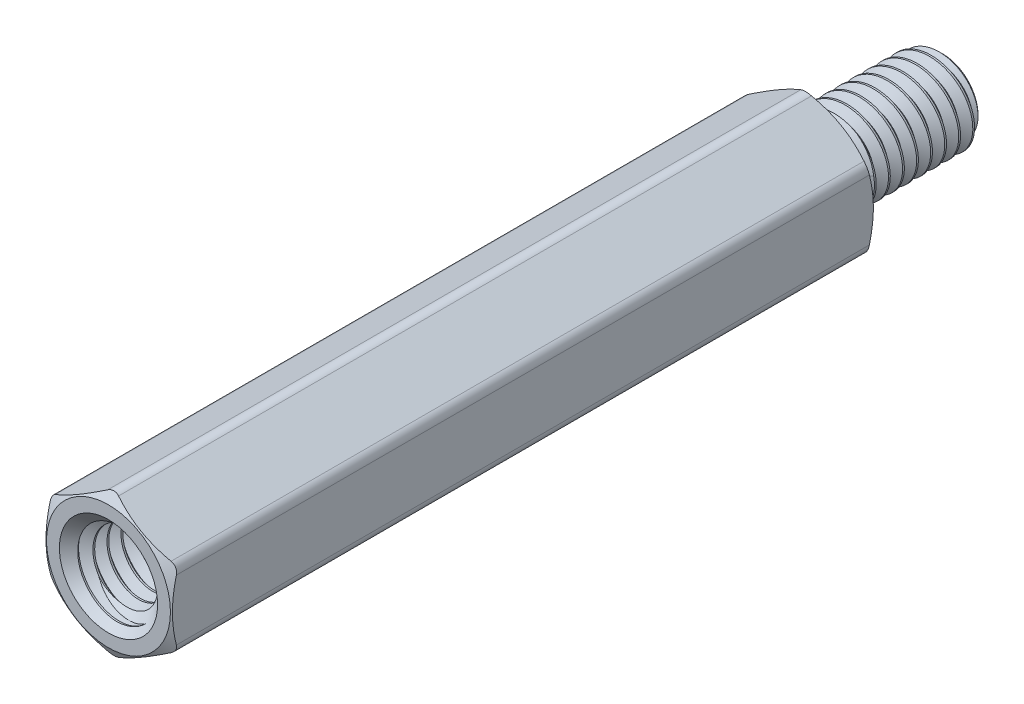
from build123d import *

# Parameters (mm, degrees)
SKETCH4_R           = 1.875
BOSS_EXTRUDE1_DEPTH = 25
SKETCH5_OUTSIDE_W   = 119.632
SKETCH5_OUTSIDE_H   = 120.328
SKETCH5_OUTSIDE_R   = 2.205
CUT_EXTRUDE1_DEPTH  = 30.898202287
CUT_EXTRUDE1_DRAFT  = -60
SKETCH6_OUTSIDE_W   = 103.478
SKETCH6_OUTSIDE_H   = 104.174
SKETCH6_OUTSIDE_R   = 2.205
CUT_EXTRUDE2_DEPTH  = 26.235144145
CUT_EXTRUDE2_DRAFT  = -60
FILLET1_R           = 0.3825
CUT_SWEEP1_PITCH    = 0.5
SKETCH9_R           = 1.75
BOSS_EXTRUDE2_DEPTH = 6.4
SKETCH10_W          = 6.4
SKETCH10_H          = 1.5
CUT_SWEEP2_PITCH    = 0.5


with BuildPart() as part:
    # Sketch3 → Revolve1 (revolve)
    with BuildSketch(Plane(origin=(0, 0, 0), x_dir=(0, 0, -1), z_dir=(1, 0, 0))):
        with BuildLine():
            Line((-18.6, 1.25), (-18.6, 0))
            Line((-18.6, 0), (4.7, 0))
            Line((4.7, 0), (4.7, 1.25))
            Line((4.7, 1.25), (4.45, 1.5))
            Line((4.45, 1.5), (0.7515, 1.5))
            Line((0.7515, 1.5), (0.564, 1.175240474))
            Line((0.564, 1.175240474), (0.25, 1.175240474))
            ThreePointArc((0.25, 1.175240474), (0.073223305, 1.248463778), (0, 1.425240474))
            Line((0, 1.425240474), (0, 2.25))
            Line((0, 2.25), (-25, 2.25))
            Line((-25, 2.25), (-25, 1.75))
            Line((-25, 1.75), (-24.75, 1.5))
            Line((-24.75, 1.5), (-18.85, 1.5))
            Line((-18.85, 1.5), (-18.6, 1.25))
        make_face()
    revolve(axis=Axis((0, 0, -4.7), (0, 0, 1)))

    # Sketch4 → Boss-Extrude1 (add)
    with BuildSketch(Plane.XY.offset(25)):
        Polygon((-2.25, 1.299038106), (-2.25, -1.299038106), (0, -2.598076211), (2.25, -1.299038106), (2.25, 1.299038106), (0, 2.598076211), align=None)
        Circle(SKETCH4_R, mode=Mode.SUBTRACT)
    extrude(amount=-BOSS_EXTRUDE1_DEPTH)


with BuildPart() as cut_extrude1_tool:
    # Sketch5 outside → Cut-Extrude1 (with draft: the straight prism first)
    with BuildSketch(Plane.XY.offset(25)):
        Rectangle(SKETCH5_OUTSIDE_W, SKETCH5_OUTSIDE_H)
        Circle(SKETCH5_OUTSIDE_R, mode=Mode.SUBTRACT)
    extrude(amount=-CUT_EXTRUDE1_DEPTH)
    # Cut-Extrude1: the draft: its side faces are tilted about the plane it starts from
    cut_extrude1_sides = [cut_extrude1_tool.faces().sort_by_distance(p)[0] for p in [
        (0, -60.164, 9.550898856),
        (59.816, 0, 9.550898856),
        (0, 60.164, 9.550898856),
        (-59.816, 0, 9.550898856),
        (-2.205, 0, 9.550898856),
    ]]
    draft(cut_extrude1_sides, Plane.XY.offset(25), CUT_EXTRUDE1_DRAFT)


with BuildPart() as part_1:
    add(part.part)

    # Cut-Extrude1: cut by cut_extrude1_tool
    add(cut_extrude1_tool.part, mode=Mode.SUBTRACT)


with BuildPart() as cut_extrude2_tool:
    # Sketch6 outside → Cut-Extrude2 (with draft: the straight prism first)
    with BuildSketch(Plane(origin=(0, 0, 0), x_dir=(-1, 0, 0), z_dir=(0, 0, -1))):
        Rectangle(SKETCH6_OUTSIDE_W, SKETCH6_OUTSIDE_H)
        Circle(SKETCH6_OUTSIDE_R, mode=Mode.SUBTRACT)
    extrude(amount=-CUT_EXTRUDE2_DEPTH)
    # Cut-Extrude2: the draft: its side faces are tilted about the plane it starts from
    cut_extrude2_sides = [cut_extrude2_tool.faces().sort_by_distance(p)[0] for p in [
        (0, -52.087, 13.117572072),
        (-51.739, 0, 13.117572072),
        (0, 52.087, 13.117572072),
        (51.739, 0, 13.117572072),
        (2.205, 0, 13.117572072),
    ]]
    draft(cut_extrude2_sides, Plane(origin=(0, 0, 0), x_dir=(-1, 0, 0), z_dir=(0, 0, -1)), CUT_EXTRUDE2_DRAFT)


with BuildPart() as part_2:
    add(part_1.part)

    # Cut-Extrude2: cut by cut_extrude2_tool
    add(cut_extrude2_tool.part, mode=Mode.SUBTRACT)

    # Fillet1
    fillet1_edges = [part_2.edges().sort_by_distance(p)[0] for p in [
        (0, 2.598076211, 12.5),
        (-2.25, -1.299038106, 12.5),
        (0, -2.598076211, 12.5),
        (2.25, -1.299038106, 12.5),
        (2.25, 1.299038106, 12.5),
        (-2.25, 1.299038106, 12.5),
    ]]
    fillet(fillet1_edges, radius=FILLET1_R)

    # Cut-Sweep1: the profile of Sketch7 profile screwed along a right-hand helix of 9.118 turns, 6 arcs to a turn; built about Z, then put on its axis
    cut_sweep1_z = Axis((0, 0, 0), (0, 0, 1))
    cut_sweep1_corners = [(1.174940474, 0, -0.187673205), (1.174940474, 0, -0.249826795), (1.527063294, 0, -0.453125), (1.527063294, 0, 0.015625)]
    with BuildLine(mode=Mode.PRIVATE) as cut_sweep1_profile:
        Line(cut_sweep1_corners[0], cut_sweep1_corners[1])
        Line(cut_sweep1_corners[1], cut_sweep1_corners[2])
        Line(cut_sweep1_corners[2], cut_sweep1_corners[3])
        Line(cut_sweep1_corners[3], cut_sweep1_corners[0])
    cut_sweep1_cap = Face(cut_sweep1_profile.wire())
    cut_sweep1_turn_angles = [0, 30, 60, 90, 120, 150, 180, 210, 240, 270, 300, 330, 360]
    cut_sweep1_turn_weights = [1, 0.8660254037844387, 1, 0.8660254037844387, 1, 0.8660254037844387, 1, 0.8660254037844387, 1, 0.8660254037844387, 1, 0.8660254037844387, 1]
    cut_sweep1_turn_rails = [Edge.make_bspline([Vector(p[0], p[1], 0).rotate(cut_sweep1_z, cut_sweep1_turn_angles[k]) / cut_sweep1_turn_weights[k] + Vector(0, 0, p[2] + CUT_SWEEP1_PITCH * cut_sweep1_turn_angles[k] / 360) for k in range(13)], [0, 0, 0, 1, 1, 2, 2, 3, 3, 4, 4, 5, 5, 6, 6, 6], 2, cut_sweep1_turn_weights) for p in cut_sweep1_corners]
    cut_sweep1_turn_sides = [Face.make_surface_from_curves(cut_sweep1_turn_rails[p[0]], cut_sweep1_turn_rails[p[1]]) for p in [(0, 1), (1, 2), (2, 3), (3, 0)]]
    cut_sweep1_last_angles = [3240, 3261.24, 3282.48]
    cut_sweep1_last_weights = [1, 0.9320711124581951, 1]
    cut_sweep1_last_rails = [Edge.make_bspline([Vector(p[0], p[1], 0).rotate(cut_sweep1_z, cut_sweep1_last_angles[k]) / cut_sweep1_last_weights[k] + Vector(0, 0, p[2] + CUT_SWEEP1_PITCH * cut_sweep1_last_angles[k] / 360) for k in range(3)], [0, 0, 0, 1, 1, 1], 2, cut_sweep1_last_weights) for p in cut_sweep1_corners]
    cut_sweep1_last_sides = [Face.make_surface_from_curves(cut_sweep1_last_rails[p[0]], cut_sweep1_last_rails[p[1]]) for p in [(0, 1), (1, 2), (2, 3), (3, 0)]]
    cut_sweep1 = Plane(origin=(0, 0, -4.7), x_dir=(0, 1, 0), z_dir=(0, 0, 1)) * Solid(Shell([*[p.moved(Location((0, 0, CUT_SWEEP1_PITCH * i))) for i in range(9) for p in cut_sweep1_turn_sides], *cut_sweep1_last_sides, cut_sweep1_cap, cut_sweep1_cap.rotate(cut_sweep1_z, 3282.48).moved(Location((0, 0, CUT_SWEEP1_PITCH * 3282.48 / 360)))]))
    add(cut_sweep1, mode=Mode.SUBTRACT)

    # Sketch9 → Boss-Extrude2 (add)
    with BuildSketch(Plane.XY.offset(18.6)):
        Circle(SKETCH9_R)
    extrude(amount=BOSS_EXTRUDE2_DEPTH)


with BuildPart() as body_2:
    # Sketch10 → Revolve2 (revolve)
    with BuildSketch(Plane(origin=(0, 0, 0), x_dir=(0, 0, -1), z_dir=(1, 0, 0))):
        with Locations((-21.8, 0.75)):
            Rectangle(SKETCH10_W, SKETCH10_H)
    revolve(axis=Axis((0, 0, -4.7), (0, 0, 1)))

    # Cut-Sweep2: the profile of Sketch12 profile screwed along a right-hand helix of 13.8 turns, 6 arcs to a turn; built about Z, then put on its axis
    cut_sweep2_z = Axis((0, 0, 0), (0, 0, 1))
    cut_sweep2_corners = [(1.174940474, 0, -0.249826795), (1.174940474, 0, -0.187673205), (1.527063294, 0, 0.015625), (1.527063294, 0, -0.453125)]
    with BuildLine(mode=Mode.PRIVATE) as cut_sweep2_profile:
        Line(cut_sweep2_corners[0], cut_sweep2_corners[1])
        Line(cut_sweep2_corners[1], cut_sweep2_corners[2])
        Line(cut_sweep2_corners[2], cut_sweep2_corners[3])
        Line(cut_sweep2_corners[3], cut_sweep2_corners[0])
    cut_sweep2_cap = Face(cut_sweep2_profile.wire())
    cut_sweep2_turn_angles = [0, 30, 60, 90, 120, 150, 180, 210, 240, 270, 300, 330, 360]
    cut_sweep2_turn_weights = [1, 0.8660254037844387, 1, 0.8660254037844387, 1, 0.8660254037844387, 1, 0.8660254037844387, 1, 0.8660254037844387, 1, 0.8660254037844387, 1]
    cut_sweep2_turn_rails = [Edge.make_bspline([Vector(p[0], p[1], 0).rotate(cut_sweep2_z, cut_sweep2_turn_angles[k]) / cut_sweep2_turn_weights[k] + Vector(0, 0, p[2] + CUT_SWEEP2_PITCH * cut_sweep2_turn_angles[k] / 360) for k in range(13)], [0, 0, 0, 1, 1, 2, 2, 3, 3, 4, 4, 5, 5, 6, 6, 6], 2, cut_sweep2_turn_weights) for p in cut_sweep2_corners]
    cut_sweep2_turn_sides = [Face.make_surface_from_curves(cut_sweep2_turn_rails[p[0]], cut_sweep2_turn_rails[p[1]]) for p in [(0, 1), (1, 2), (2, 3), (3, 0)]]
    cut_sweep2_last_angles = [4680, 4710, 4740, 4770, 4800, 4830, 4860, 4890, 4920, 4944, 4968]
    cut_sweep2_last_weights = [1, 0.8660254037844387, 1, 0.8660254037844387, 1, 0.8660254037844387, 1, 0.8660254037844387, 1, 0.9135454576426073, 1]
    cut_sweep2_last_rails = [Edge.make_bspline([Vector(p[0], p[1], 0).rotate(cut_sweep2_z, cut_sweep2_last_angles[k]) / cut_sweep2_last_weights[k] + Vector(0, 0, p[2] + CUT_SWEEP2_PITCH * cut_sweep2_last_angles[k] / 360) for k in range(11)], [0, 0, 0, 1, 1, 2, 2, 3, 3, 4, 4, 5, 5, 5], 2, cut_sweep2_last_weights) for p in cut_sweep2_corners]
    cut_sweep2_last_sides = [Face.make_surface_from_curves(cut_sweep2_last_rails[p[0]], cut_sweep2_last_rails[p[1]]) for p in [(0, 1), (1, 2), (2, 3), (3, 0)]]
    cut_sweep2 = Plane(origin=(0, 0, 25), x_dir=(0, 1, 0), z_dir=(0, 0, -1)) * Solid(Shell([*[p.moved(Location((0, 0, CUT_SWEEP2_PITCH * i))) for i in range(13) for p in cut_sweep2_turn_sides], *cut_sweep2_last_sides, cut_sweep2_cap, cut_sweep2_cap.rotate(cut_sweep2_z, 4968).moved(Location((0, 0, CUT_SWEEP2_PITCH * 4968 / 360)))]))
    add(cut_sweep2, mode=Mode.SUBTRACT)


with BuildPart() as part_3:
    add(part_2.part)

    # Combine1: cut body 2
    add(body_2.part, mode=Mode.SUBTRACT)

    # Cut-Extrude3 cone 1 section (through the dimple's axis) → Cut-Extrude3 (revolve, cut)
    with BuildSketch(Plane(origin=(0, 0, 25), x_dir=(0, -1, 0), z_dir=(1, 0, 0))):
        Polygon((0, 0), (1.7475, 0), (0, 1.7475), align=None)
    revolve(axis=Axis((0, 0, 25), (0, 0, -1)), mode=Mode.SUBTRACT)


solid = part_3.part
